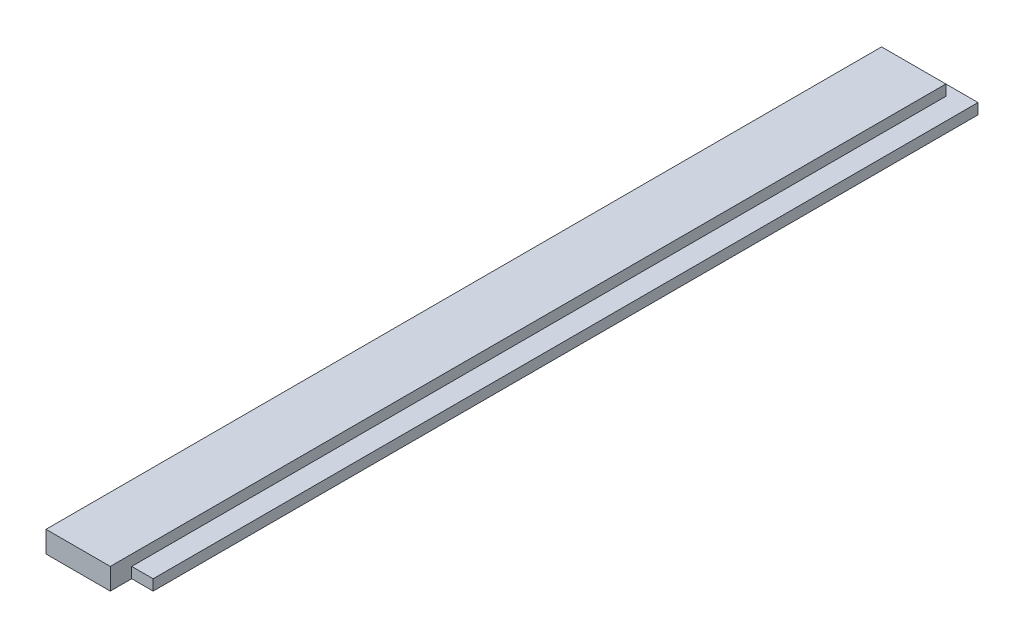
from build123d import *

# Parameters (mm, degrees)
BOSS_EXTRUDE1_DEPTH = 501.65
SKETCH3_W           = 38.1
SKETCH3_H           = 6.35
CUT_EXTRUDE1_DEPTH  = 6.35
SKETCH4_W           = 12.7
SKETCH4_H           = 12.7
CUT_EXTRUDE4_DEPTH  = 505.375507435


with BuildPart() as part:
    # Sketch1 → Boss-Extrude1 (new body)
    with BuildSketch(Plane.XY):
        Polygon((0, 12.7), (38.1, 12.7), (38.1, 6.35), (50.8, 6.35), (50.8, 0), (0, 0), align=None)
    extrude(amount=BOSS_EXTRUDE1_DEPTH)

    # Sketch3 → Cut-Extrude1 (cut)
    with BuildSketch(Plane(origin=(0, 12.7, 0), x_dir=(1, 0, 0), z_dir=(0, 1, 0))):
        with Locations((19.05, -3.175)):
            Rectangle(SKETCH3_W, SKETCH3_H)
    extrude(amount=-CUT_EXTRUDE1_DEPTH, mode=Mode.SUBTRACT)

    # Sketch4 → Cut-Extrude4 (cut, through all)
    with BuildSketch(Plane.XZ):
        with Locations((44.45, 495.3)):
            Rectangle(SKETCH4_W, SKETCH4_H)
    extrude(amount=-CUT_EXTRUDE4_DEPTH, mode=Mode.SUBTRACT)


solid = part.part
